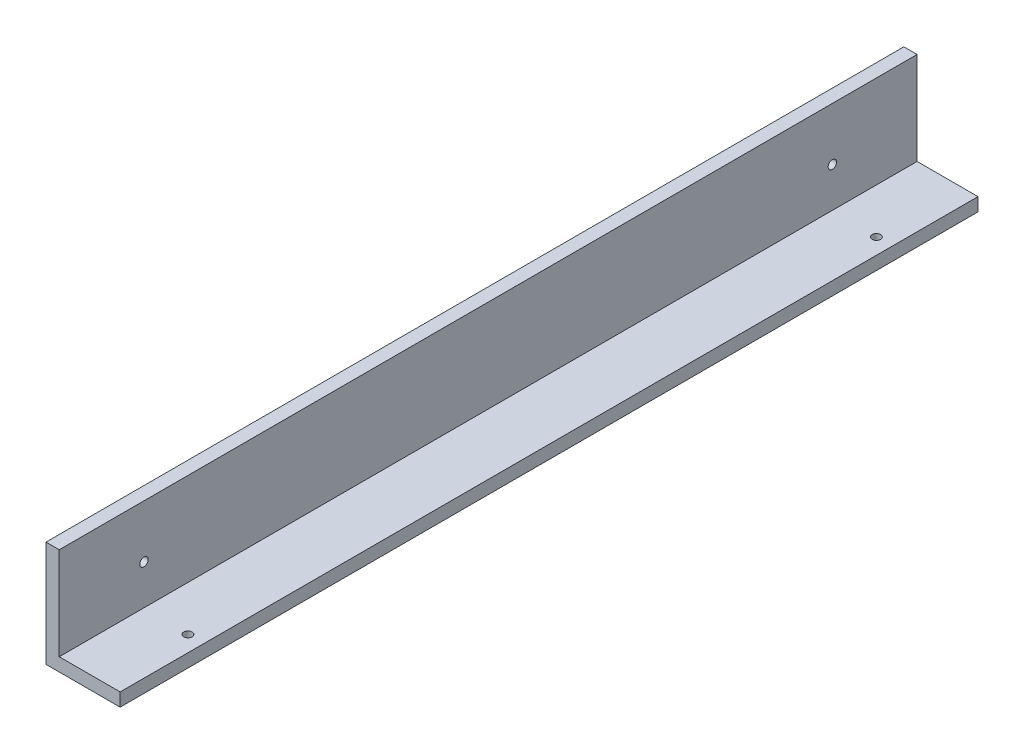
from build123d import *

# Parameters (mm, degrees)
BOSS_EXTRUDE1_DEPTH        = 411.48
F_10_32_TAPPED_HOLE5_D     = 4.0386
F_10_32_TAPPED_HOLE6_D     = 4.0386
F_10_32_TAPPED_HOLE7_D     = 4.0386
F_10_32_TAPPED_HOLE7_DEPTH = 11.938
F_10_32_TAPPED_HOLE7_TIP   = 1.213317848
F_10_32_TAPPED_HOLE8_D     = 4.0386
F_10_32_TAPPED_HOLE8_DEPTH = 11.938
F_10_32_TAPPED_HOLE8_TIP   = 1.213317848


with BuildPart() as part:
    # Sketch1 → Boss-Extrude1 (new body)
    with BuildSketch(Plane.XY):
        Polygon((0, 0), (0, 50.8), (6.35, 50.8), (6.35, 6.35), (35.56, 6.35), (35.56, 0), align=None)
    extrude(amount=BOSS_EXTRUDE1_DEPTH)

    # #10-32 Tapped Hole5 (through all)
    with Locations(Plane(origin=(6.35, 0, 0), x_dir=(0, 0, -1), z_dir=(1, 0, 0))):
        with Locations((-370.84, 25.4)):
            Hole(F_10_32_TAPPED_HOLE5_D / 2)

    # #10-32 Tapped Hole6 (through all)
    with Locations(Plane(origin=(6.35, 0, 0), x_dir=(0, 0, -1), z_dir=(1, 0, 0))):
        with Locations((-40.64, 25.4)):
            Hole(F_10_32_TAPPED_HOLE6_D / 2)

    # #10-32 Tapped Hole7
    with Locations(Plane(origin=(0, 6.35, 0), x_dir=(-1, 0, 0), z_dir=(0, 1, 0))):
        with Locations((-27.94, 41.135307591)):
            Hole(F_10_32_TAPPED_HOLE7_D / 2, depth=F_10_32_TAPPED_HOLE7_DEPTH)
            with Locations((0, 0, -(F_10_32_TAPPED_HOLE7_DEPTH + F_10_32_TAPPED_HOLE7_TIP / 2))):  # 118° drill point
                Cone(0, F_10_32_TAPPED_HOLE7_D / 2, F_10_32_TAPPED_HOLE7_TIP, mode=Mode.SUBTRACT)

    # #10-32 Tapped Hole8
    with Locations(Plane(origin=(0, 6.35, 0), x_dir=(-1, 0, 0), z_dir=(0, 1, 0))):
        with Locations((-27.94, 371.335307591)):
            Hole(F_10_32_TAPPED_HOLE8_D / 2, depth=F_10_32_TAPPED_HOLE8_DEPTH)
            with Locations((0, 0, -(F_10_32_TAPPED_HOLE8_DEPTH + F_10_32_TAPPED_HOLE8_TIP / 2))):  # 118° drill point
                Cone(0, F_10_32_TAPPED_HOLE8_D / 2, F_10_32_TAPPED_HOLE8_TIP, mode=Mode.SUBTRACT)


solid = part.part
